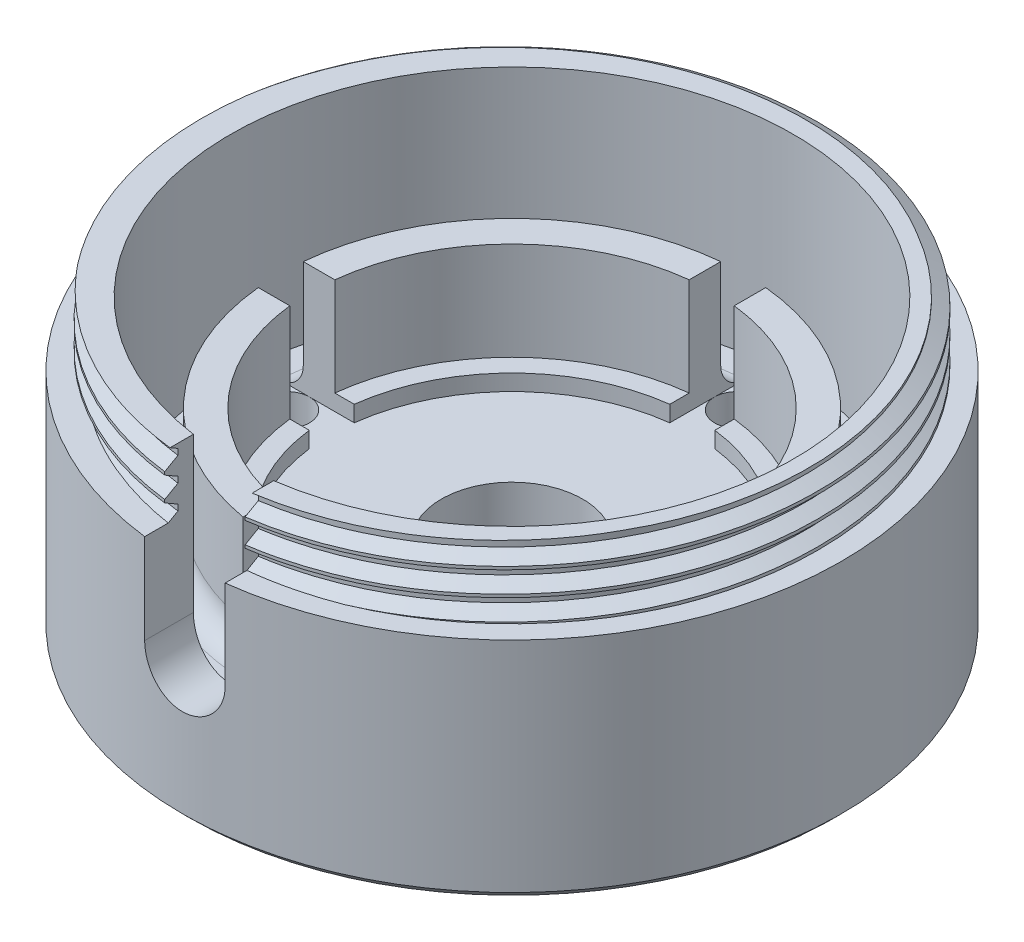
from build123d import *

# Parameters (mm, degrees)
SKETCH1_R      = 20.5
SKETCH1_R_2    = 4.4
SKETCH1_R_3    = 1.4
EXTRUDE1_DEPTH = 5
EXTRUDE2_DEPTH = 7.1
SKETCH7_R      = 12.5
EXTRUDE5_DEPTH = 6.1
FILLET1_R      = 1.5
SKETCH8_R      = 20.5
SKETCH8_R_2    = 17.5
EXTRUDE6_DEPTH = 9.1
SKETCH4_R      = 18.45
SKETCH4_R_2    = 17.5
EXTRUDE4_DEPTH = 4
THREAD1_PITCH  = 1.5
THREAD1_FROM   = 2
CHAMFER2_SIZE  = 1.5
CHAMFER3_SIZE  = 0.5
CHAMFER4_SIZE  = 1
EXTRUDE7_DEPTH = 35.177624432


with BuildPart() as part:
    # Sketch1 → Extrude1 (new body)
    with BuildSketch(Plane(origin=(0, 0, 0), x_dir=(1, 0, 0), z_dir=(0, 1, 0))):
        with Locations(Location((0, 0, 0), (0, 0, 270))):
            Circle(SKETCH1_R)
        with Locations(Location((0, 0, 0), (0, 0, 270))):
            Circle(SKETCH1_R_2, mode=Mode.SUBTRACT)
        with Locations(Location((0, 14, 0), (0, 0, 270))):
            Circle(SKETCH1_R_3, mode=Mode.SUBTRACT)
        with Locations(Location((14, 0, 0), (0, 0, 270))):
            Circle(SKETCH1_R_3, mode=Mode.SUBTRACT)
        with Locations(Location((0, -14, 0), (0, 0, 270))):
            Circle(SKETCH1_R_3, mode=Mode.SUBTRACT)
        with Locations(Location((-14, 0, 0), (0, 0, 270))):
            Circle(SKETCH1_R_3, mode=Mode.SUBTRACT)
    extrude(amount=EXTRUDE1_DEPTH)

    # Sketch2 → Extrude2 (add)
    with BuildSketch(Plane(origin=(0, 5, 0), x_dir=(1, 0, 0), z_dir=(0, 1, 0))):
        with BuildLine():
            Line((-1.4, 14.382020025), (-1.4, 11.212938955))
            ThreePointArc((-1.4, 11.212938955), (-7.990306627, 7.990306627), (-11.212938955, 1.4))
            Line((-11.212938955, 1.4), (-14.382020025, 1.4))
            ThreePointArc((-14.382020025, 1.4), (-10.217692988, 10.217692988), (-1.4, 14.382020025))
        make_face()
        with BuildLine():
            Line((1.4, 14.382020025), (1.4, 11.212938955))
            ThreePointArc((1.4, 11.212938955), (7.990306627, 7.990306627), (11.212938955, 1.4))
            Line((11.212938955, 1.4), (14.382020025, 1.4))
            ThreePointArc((14.382020025, 1.4), (10.217692988, 10.217692988), (1.4, 14.382020025))
        make_face()
        with BuildLine():
            Line((14.382020025, -1.4), (11.212938955, -1.4))
            ThreePointArc((11.212938955, -1.4), (7.990306627, -7.990306627), (1.4, -11.212938955))
            Line((1.4, -11.212938955), (1.4, -14.382020025))
            ThreePointArc((1.4, -14.382020025), (10.217692988, -10.217692988), (14.382020025, -1.4))
        make_face()
        with BuildLine():
            Line((-1.4, -14.382020025), (-1.4, -11.212938955))
            ThreePointArc((-1.4, -11.212938955), (-7.990306627, -7.990306627), (-11.212938955, -1.4))
            Line((-11.212938955, -1.4), (-14.382020025, -1.4))
            ThreePointArc((-14.382020025, -1.4), (-10.217692988, -10.217692988), (-1.4, -14.382020025))
        make_face()
    extrude(amount=EXTRUDE2_DEPTH)

    # Sketch7 → Extrude5 (cut)
    with BuildSketch(Plane(origin=(0, 12.1, 0), x_dir=(1, 0, 0), z_dir=(0, 1, 0))):
        Circle(SKETCH7_R)
    extrude(amount=-EXTRUDE5_DEPTH, mode=Mode.SUBTRACT)

    # Fillet1
    fillet1_edges = [part.edges().sort_by_distance(p)[0] for p in [
        (-10.217692988, 5, -10.217692988),
        (10.217692988, 5, -10.217692988),
        (10.217692988, 5, 10.217692988),
        (-10.217692988, 5, 10.217692988),
    ]]
    fillet(fillet1_edges, radius=FILLET1_R)

    # Sketch8 → Extrude6 (add)
    with BuildSketch(Plane(origin=(0, 5, 0), x_dir=(1, 0, 0), z_dir=(0, 1, 0))):
        with Locations(Location((0, 0, 0), (0, 0, 270))):
            Circle(SKETCH8_R)
        with Locations(Location((0, 0, 0), (0, 0, 270))):
            Circle(SKETCH8_R_2, mode=Mode.SUBTRACT)
    extrude(amount=EXTRUDE6_DEPTH)

    # Sketch4 → Extrude4 (add)
    with BuildSketch(Plane(origin=(0, 14.1, 0), x_dir=(1, 0, 0), z_dir=(0, 1, 0))):
        with Locations(Location((0, 0, 0), (0, 0, 270))):
            Circle(SKETCH4_R)
        with Locations(Location((0, 0, 0), (0, 0, 270))):
            Circle(SKETCH4_R_2, mode=Mode.SUBTRACT)
    extrude(amount=EXTRUDE4_DEPTH)

    # Thread1: arcs per turn and ends read off the stored shape
    # Thread1: the profile of Sketch6 profile screwed along a right-hand helix through 10.066667 turns, 8 arcs to a turn; built about Z, then put on its axis
    thread1_z = Axis((0, 0, 0), (0, 0, 1))
    thread1_corners = [(18.4497, 0, -0.000173205), (19.261898813, 0, 0.468749998), (19.261898813, 0, 0.656249998), (18.4497, 0, 1.125173201)]
    with BuildLine(mode=Mode.PRIVATE) as thread1_profile:
        Line(thread1_corners[0], thread1_corners[1])
        Line(thread1_corners[1], thread1_corners[2])
        Line(thread1_corners[2], thread1_corners[3])
        Line(thread1_corners[3], thread1_corners[0])
    thread1_cap = Face(thread1_profile.wire())
    thread1_turn_angles = [0, 22.5, 45, 67.5, 90, 112.5, 135, 157.5, 180, 202.5, 225, 247.5, 270, 292.5, 315, 337.5, 360]
    thread1_turn_weights = [1, 0.9238795325112867, 1, 0.9238795325112867, 1, 0.9238795325112867, 1, 0.9238795325112867, 1, 0.9238795325112867, 1, 0.9238795325112867, 1, 0.9238795325112867, 1, 0.9238795325112867, 1]
    thread1_turn_rails = [Edge.make_bspline([Vector(p[0], p[1], 0).rotate(thread1_z, thread1_turn_angles[k]) / thread1_turn_weights[k] + Vector(0, 0, p[2] + THREAD1_PITCH * thread1_turn_angles[k] / 360) for k in range(17)], [0, 0, 0, 1, 1, 2, 2, 3, 3, 4, 4, 5, 5, 6, 6, 7, 7, 8, 8, 8], 2, thread1_turn_weights) for p in thread1_corners]
    thread1_turn_sides = [Face.make_surface_from_curves(thread1_turn_rails[p[0]], thread1_turn_rails[p[1]]) for p in [(0, 1), (1, 2), (2, 3), (3, 0)]]
    thread1_last_angles = [3600, 3612, 3624]
    thread1_last_weights = [1, 0.9781476007338065, 1]
    thread1_last_rails = [Edge.make_bspline([Vector(p[0], p[1], 0).rotate(thread1_z, thread1_last_angles[k]) / thread1_last_weights[k] + Vector(0, 0, p[2] + THREAD1_PITCH * thread1_last_angles[k] / 360) for k in range(3)], [0, 0, 0, 1, 1, 1], 2, thread1_last_weights) for p in thread1_corners]
    thread1_last_sides = [Face.make_surface_from_curves(thread1_last_rails[p[0]], thread1_last_rails[p[1]]) for p in [(0, 1), (1, 2), (2, 3), (3, 0)]]
    thread1 = Plane(origin=(0, 20.1, 0), x_dir=(-1, 0, 0), z_dir=(0, -1, 0)) * split(Solid(Shell([*[p.moved(Location((0, 0, THREAD1_PITCH * i))) for i in range(10) for p in thread1_turn_sides], *thread1_last_sides, thread1_cap, thread1_cap.rotate(thread1_z, 3624).moved(Location((0, 0, THREAD1_PITCH * 3624 / 360)))])), bisect_by=Plane.XY.offset(THREAD1_FROM), keep=Keep.TOP, mode=Mode.PRIVATE)
    add(thread1)

    # Chamfer2
    chamfer2_edges = [part.edges().sort_by_distance(p)[0] for p in [
        (0, 0, -4.4),
    ]]
    chamfer(chamfer2_edges, length=CHAMFER2_SIZE)

    # Chamfer3
    chamfer3_edges = [part.edges().sort_by_distance(p)[0] for p in [
        (0, 0, -20.5),
    ]]
    chamfer(chamfer3_edges, length=CHAMFER3_SIZE)

    # Chamfer4
    chamfer4_edges = [part.edges().sort_by_distance(p)[0] for p in [
        (14, 0, -1.4),
        (0, 0, 12.6),
        (-14, 0, -1.4),
        (0, 0, -15.4),
    ]]
    chamfer(chamfer4_edges, length=CHAMFER4_SIZE)

    # Sketch9 → Extrude7 (cut, through all)
    with BuildSketch(Plane.XY):
        with BuildLine():
            Line((-2.5, 8.5), (-2.5, 19.1))
            Line((-2.5, 19.1), (2.5, 19.1))
            Line((2.5, 19.1), (2.5, 8.5))
            ThreePointArc((2.5, 8.5), (0, 6), (-2.5, 8.5))
        make_face()
    extrude(amount=EXTRUDE7_DEPTH, mode=Mode.SUBTRACT)


solid = part.part
